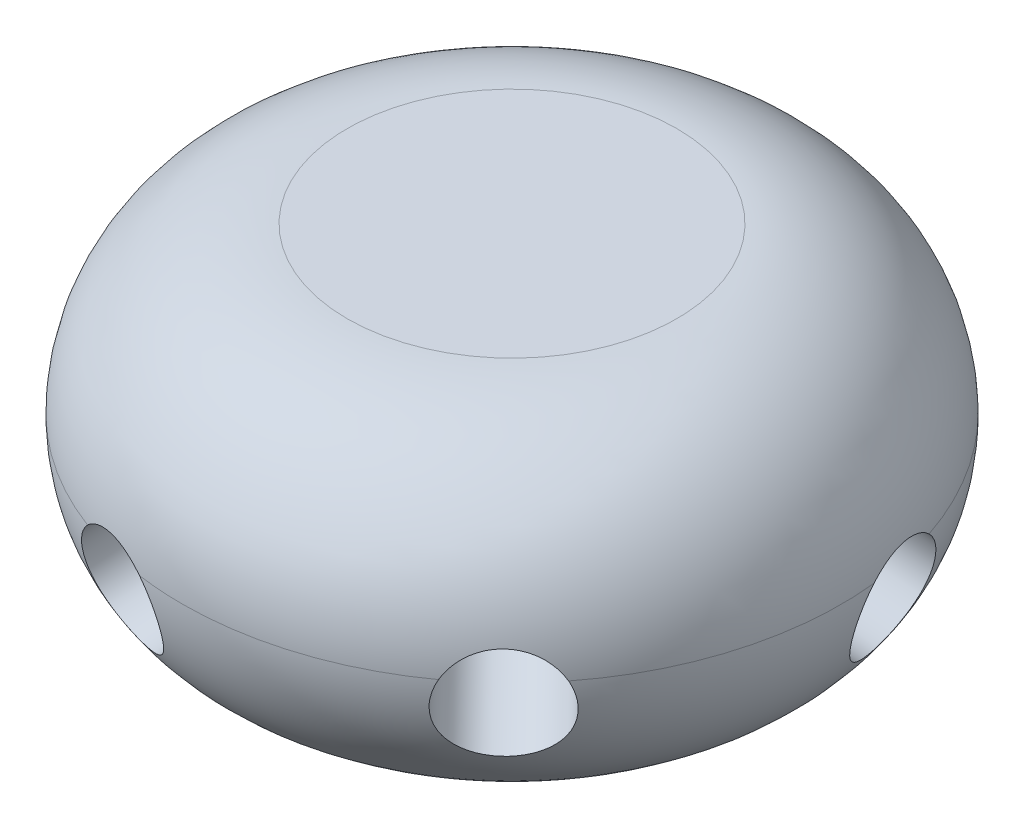
from build123d import *

# Parameters (mm, degrees)
BASE_DEPTH        = 3
BASE_DEPTH_BACK   = 7
SKETCH1_R         = 10
SKETCH2_R         = 1.6
HOLE1_DEPTH       = 19.934353276
HOLE1MIRROR_COUNT = 2
SKETCH3_R         = 1.6
HOLE2_DEPTH       = 19.445737601
HOLE2MIRROR_COUNT = 2
SKETCH4_R         = 1.6
HOLE3_DEPTH       = 19.389503466
HOLE3MIRROR_COUNT = 2
FILLET1_R         = 5


with BuildPart() as part:
    # Sketch1 → base (new, two sides: drawn at the far end of the back side and taken through both)
    with BuildSketch(Plane(origin=(0, 0, 0), x_dir=(1, 0, 0), z_dir=(0, 1, 0)).offset(-BASE_DEPTH_BACK)):
        with Locations(Location((0, 0, 0), (0, 0, 270))):
            Circle(SKETCH1_R)
    extrude(amount=BASE_DEPTH + BASE_DEPTH_BACK)

    # Sketch2 → hole1 (cut, through all)
    with BuildSketch(Plane(origin=(2.670502563, -1.093066116, 2.770130417), x_dir=(-0.6558691872850446, 0.22429081675253856, 0.7207837669443827), z_dir=(-0.6676256406563905, 0.27326652891267483, -0.692532604369038))):
        with Locations(Location((0, 0, 0), (0, 0, 346.516491398))):
            Circle(SKETCH2_R)
    hole1 = extrude(amount=-HOLE1_DEPTH, mode=Mode.SUBTRACT)

    # hole1mirror: hole1 ×2 about axis
    hole1mirror_axis = Axis((0, 5.5, 0), (0, -1, 0))
    for i in range(1, HOLE1MIRROR_COUNT):
        add(hole1.rotate(hole1mirror_axis, i * 360 / HOLE1MIRROR_COUNT), mode=Mode.SUBTRACT)

    # Sketch3 → hole2 (cut, through all)
    with BuildSketch(Plane(origin=(-0.941672921, -1.236067977, 3.685836142), x_dir=(-0.9718935871364875, 0.07382318789513377, -0.22354639834264944), z_dir=(0.23541823021467095, 0.3090169943749464, -0.921459035481267))):
        with Locations(Location((0, 0, 0), (0, 0, 90.062171088))):
            Circle(SKETCH3_R)
    hole2 = extrude(amount=-HOLE2_DEPTH, mode=Mode.SUBTRACT)

    # hole2mirror: hole2 ×2 about axis
    hole2mirror_axis = Axis((0, 5.5, 0), (0, -1, 0))
    for i in range(1, HOLE2MIRROR_COUNT):
        add(hole2.rotate(hole2mirror_axis, i * 360 / HOLE2MIRROR_COUNT), mode=Mode.SUBTRACT)

    # Sketch4 → hole3 (cut, through all)
    with BuildSketch(Plane(origin=(-3.717841, -1.236067977, 0.806098168), x_dir=(-0.19123247894507908, -0.06357892752956036, -0.979483465389136), z_dir=(0.9294602499075393, 0.30901699437494623, -0.20152454200243008))):
        with Locations(Location((0, 0, 0), (0, 0, 90))):
            Circle(SKETCH4_R)
    hole3 = extrude(amount=-HOLE3_DEPTH, mode=Mode.SUBTRACT)

    # hole3mirror: hole3 ×2 about axis
    hole3mirror_axis = Axis((0, 5.5, 0), (0, -1, 0))
    for i in range(1, HOLE3MIRROR_COUNT):
        add(hole3.rotate(hole3mirror_axis, i * 360 / HOLE3MIRROR_COUNT), mode=Mode.SUBTRACT)

    # Fillet1
    # the kernel refuses this fillet: 5 mm, written as the material it takes off along each edge
    with BuildSketch(Plane(origin=(0, -7, 0), x_dir=(0, 0, 1), z_dir=(-1, 0, 0))) as fillet1_piece_1:
        with BuildLine():
            CenterArc((10 - FILLET1_R, FILLET1_R), FILLET1_R, 270, 90)
            Line((10 - FILLET1_R, 0), (10, 0))
            Line((10, 0), (10, FILLET1_R))
        make_face()
    revolve(axis=Axis((0, -7, 0), (0, 1, 0)), mode=Mode.SUBTRACT)
    with BuildSketch(Plane(origin=(0, 3, 0), x_dir=(0, 0, 1), z_dir=(-1, 0, 0))) as fillet1_piece_2:
        with BuildLine():
            CenterArc((10 - FILLET1_R, -FILLET1_R), FILLET1_R, 0, 90)
            Line((10 - FILLET1_R, 0), (10, 0))
            Line((10, 0), (10, -FILLET1_R))
        make_face()
    revolve(axis=Axis((0, 3, 0), (0, 1, 0)), mode=Mode.SUBTRACT)


solid = part.part
